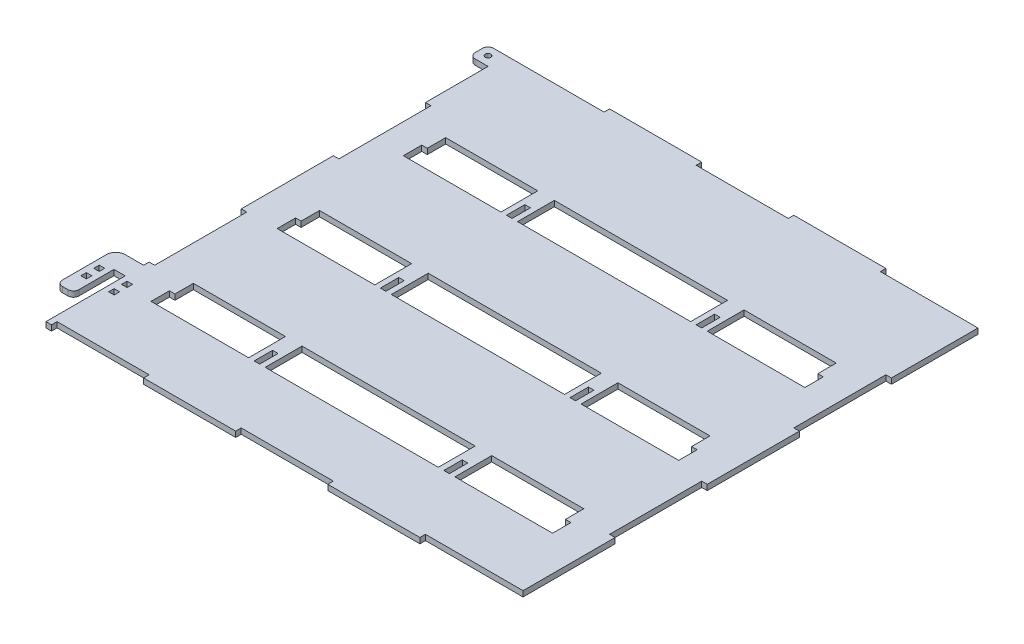
from build123d import *

# Parameters (mm, degrees)
SKETCH1_R           = 1.5
SKETCH1_W           = 3
SKETCH1_H           = 3
SKETCH1_H_2         = 10
SKETCH1_W_2         = 94
SKETCH1_H_3         = 20
BOSS_EXTRUDE1_DEPTH = 3


with BuildPart() as part:
    # Sketch1 → Boss-Extrude1 (new body)
    with BuildSketch(Plane(origin=(0, 0, 0), x_dir=(1, 0, 0), z_dir=(0, 1, 0))):
        with BuildLine():
            Line((256, 100), (256, 150))
            Line((256, 150), (253, 150))
            Line((253, 150), (253, 200))
            Line((253, 200), (256, 200))
            Line((256, 200), (256, 247))
            Line((256, 247), (203, 247))
            Line((203, 247), (203, 250))
            Line((203, 250), (153, 250))
            Line((153, 250), (153, 247))
            Line((153, 247), (103, 247))
            Line((103, 247), (103, 250))
            Line((103, 250), (53, 250))
            Line((53, 250), (53, 247))
            Line((53, 247), (-7, 247))
            ThreePointArc((-7, 247), (-9.121320344, 246.121320344), (-10, 244))
            Line((-10, 244), (-10, 240))
            ThreePointArc((-10, 240), (-9.121320344, 237.878679656), (-7, 237))
            Line((-7, 237), (0, 237))
            Line((0, 237), (0, 203))
            Line((0, 203), (3, 203))
            Line((3, 203), (3, 153))
            Line((3, 153), (0, 153))
            Line((0, 153), (0, 103))
            Line((0, 103), (3, 103))
            Line((3, 103), (3, 53))
            Line((3, 53), (0, 53))
            Line((0, 53), (0, 50))
            Line((0, 50), (-10.1, 50))
            ThreePointArc((-10.1, 50), (-13.635533906, 48.535533906), (-15.1, 45))
            Line((-15.1, 45), (-15.1, 43))
            Line((-15.1, 43), (-15.1, 21))
            ThreePointArc((-15.1, 21), (-14.221320344, 18.878679656), (-12.1, 18))
            Line((-12.1, 18), (-9.1, 18))
            ThreePointArc((-9.1, 18), (-6.978679656, 18.878679656), (-6.1, 21))
            Line((-6.1, 21), (-6.1, 40))
            Line((-6.1, 40), (0, 40))
            Line((0, 40), (0, 0))
            Line((0, 0), (0, -3))
            Line((0, -3), (3, -3))
            Line((3, -3), (3, 0))
            Line((3, 0), (53, 0))
            Line((53, 0), (53, -3))
            Line((53, -3), (103, -3))
            Line((103, -3), (103, 0))
            Line((103, 0), (153, 0))
            Line((153, 0), (153, -3))
            Line((153, -3), (203, -3))
            Line((203, -3), (203, 0))
            Line((203, 0), (256, 0))
            Line((256, 0), (256, 50))
            Line((256, 50), (253, 50))
            Line((253, 50), (253, 100))
            Line((253, 100), (256, 100))
        make_face()
        with Locations((-5, 242)):
            Circle(SKETCH1_R, mode=Mode.SUBTRACT)
        with Locations((-10.6, 29.5)):
            Rectangle(SKETCH1_W, SKETCH1_H, mode=Mode.SUBTRACT)
        Polygon((184, 172), (234, 172), (237, 172), (237, 182), (234, 182), (234, 192), (184, 192), align=None, mode=Mode.SUBTRACT)
        with Locations((-10.6, 36.5)):
            Rectangle(SKETCH1_W, SKETCH1_H, mode=Mode.SUBTRACT)
        with Locations((4.5, 29.5)):
            Rectangle(SKETCH1_W, SKETCH1_H, mode=Mode.SUBTRACT)
        with Locations((4.5, 36.5)):
            Rectangle(SKETCH1_W, SKETCH1_H, mode=Mode.SUBTRACT)
        with Locations((76.5, 40)):
            Rectangle(SKETCH1_W, SKETCH1_H_2, mode=Mode.SUBTRACT)
        with Locations((179.5, 40)):
            Rectangle(SKETCH1_W, SKETCH1_H_2, mode=Mode.SUBTRACT)
        with Locations((76.5, 108.5)):
            Rectangle(SKETCH1_W, SKETCH1_H_2, mode=Mode.SUBTRACT)
        Polygon((22, 172), (72, 172), (72, 192), (22, 192), (22, 182), (19, 182), (19, 172), align=None, mode=Mode.SUBTRACT)
        with Locations((179.5, 108.5)):
            Rectangle(SKETCH1_W, SKETCH1_H_2, mode=Mode.SUBTRACT)
        with Locations((128, 113.5)):
            Rectangle(SKETCH1_W_2, SKETCH1_H_3, mode=Mode.SUBTRACT)
        with Locations((76.5, 177)):
            Rectangle(SKETCH1_W, SKETCH1_H_2, mode=Mode.SUBTRACT)
        Polygon((184, 123.5), (234, 123.5), (234, 113.5), (237, 113.5), (237, 103.5), (234, 103.5), (184, 103.5), align=None, mode=Mode.SUBTRACT)
        with Locations((179.5, 177)):
            Rectangle(SKETCH1_W, SKETCH1_H_2, mode=Mode.SUBTRACT)
        Polygon((22, 35), (72, 35), (72, 55), (22, 55), (22, 45), (19, 45), (19, 35), align=None, mode=Mode.SUBTRACT)
        Polygon((234, 45), (234, 55), (184, 55), (184, 35), (234, 35), (237, 35), (237, 45), align=None, mode=Mode.SUBTRACT)
        Polygon((22, 103.5), (72, 103.5), (72, 123.5), (22, 123.5), (22, 113.5), (19, 113.5), (19, 103.5), align=None, mode=Mode.SUBTRACT)
        with Locations((128, 182)):
            Rectangle(SKETCH1_W_2, SKETCH1_H_3, mode=Mode.SUBTRACT)
        with Locations((128, 45)):
            Rectangle(SKETCH1_W_2, SKETCH1_H_3, mode=Mode.SUBTRACT)
    extrude(amount=BOSS_EXTRUDE1_DEPTH)


solid = part.part
